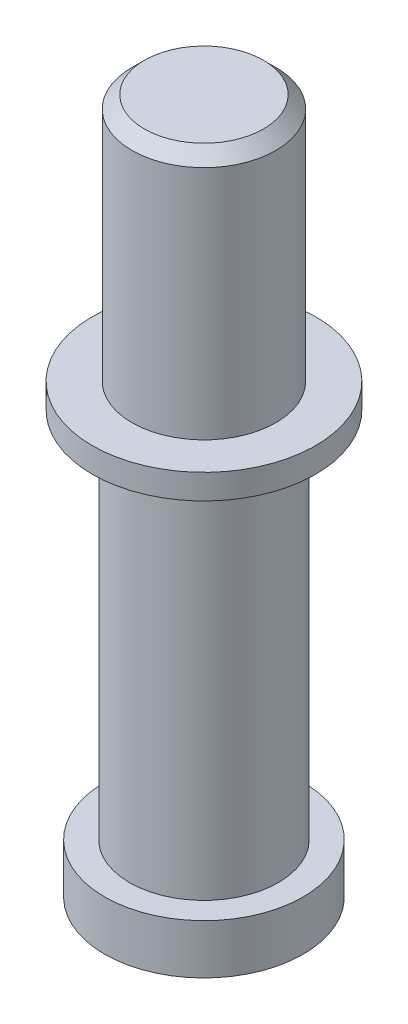
from build123d import *

# Parameters (mm, degrees)
SKETCH2_R           = 2
BOSS_EXTRUDE1_DEPTH = 1
SKETCH3_R           = 1.5
BOSS_EXTRUDE2_DEPTH = 7.5
SKETCH4_R           = 2.25
BOSS_EXTRUDE3_DEPTH = 0.5
SKETCH5_R           = 1.45
BOSS_EXTRUDE4_DEPTH = 5
CHAMFER3_SIZE       = 0.25


with BuildPart() as part:
    # Sketch2 → Boss-Extrude1 (new body)
    with BuildSketch(Plane(origin=(0, 0, 0), x_dir=(1, 0, 0), z_dir=(0, 1, 0))):
        Circle(SKETCH2_R)
    extrude(amount=BOSS_EXTRUDE1_DEPTH)

    # Sketch3 → Boss-Extrude2 (add)
    with BuildSketch(Plane(origin=(0, 1, 0), x_dir=(1, 0, 0), z_dir=(0, 1, 0))):
        Circle(SKETCH3_R)
    extrude(amount=BOSS_EXTRUDE2_DEPTH)

    # Sketch4 → Boss-Extrude3 (add)
    with BuildSketch(Plane(origin=(0, 8.5, 0), x_dir=(1, 0, 0), z_dir=(0, 1, 0))):
        Circle(SKETCH4_R)
    extrude(amount=BOSS_EXTRUDE3_DEPTH)

    # Sketch5 → Boss-Extrude4 (add)
    with BuildSketch(Plane(origin=(0, 9, 0), x_dir=(1, 0, 0), z_dir=(0, 1, 0))):
        Circle(SKETCH5_R)
    extrude(amount=BOSS_EXTRUDE4_DEPTH)

    # Chamfer3
    chamfer3_edges = [part.edges().sort_by_distance(p)[0] for p in [
        (-1.45, 14, 0),
    ]]
    chamfer(chamfer3_edges, length=CHAMFER3_SIZE)


solid = part.part
